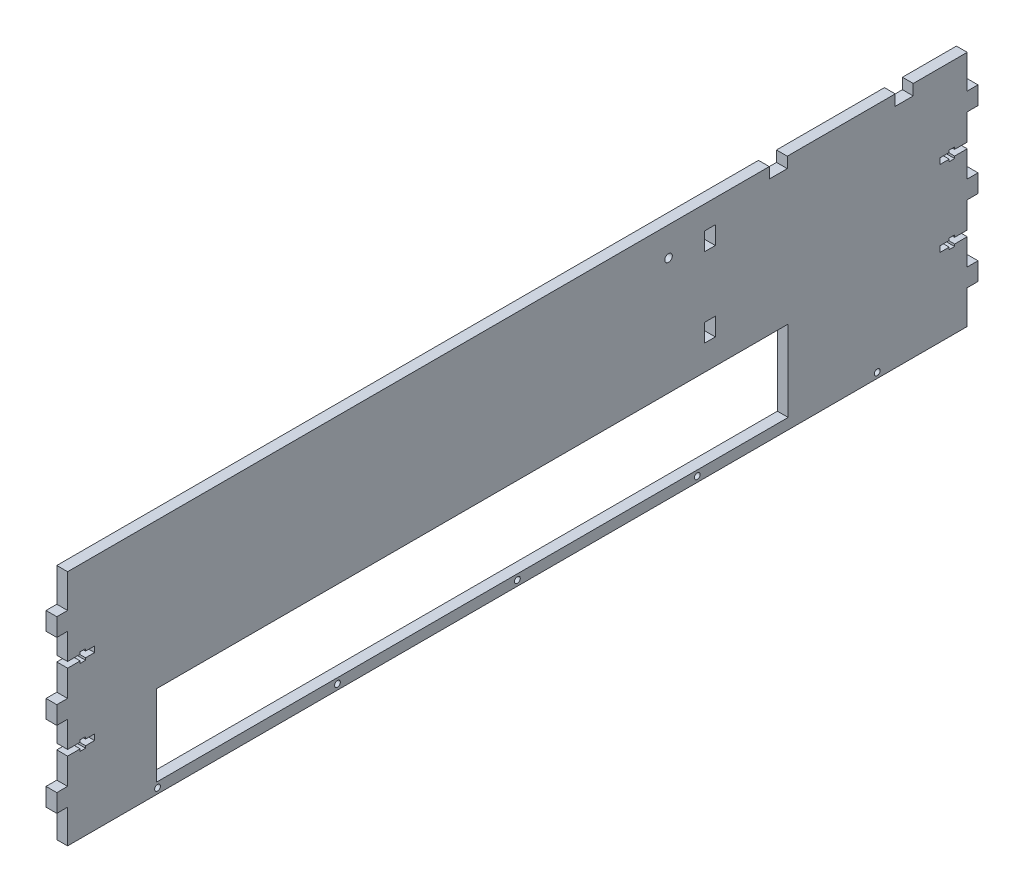
from build123d import *

# Parameters (mm, degrees)
SKETCH1_W           = 500
SKETCH1_H           = 132
BOSS_EXTRUDE1_DEPTH = 6
SKETCH4_W           = 6
SKETCH4_H           = 10
BOSS_EXTRUDE2_DEPTH = 6
CUT_EXTRUDE3_REACH  = 266.439
SKETCH6_W           = 6
SKETCH6_H           = 10
BOSS_EXTRUDE3_DEPTH = 6
CUT_EXTRUDE4_REACH  = 266.439
CUT_EXTRUDE5_REACH  = 266.439
SKETCH8_W           = 351
SKETCH8_H           = 44.95
CUT_EXTRUDE7_REACH  = 266.439
SKETCH10_R          = 1.6
CUT_EXTRUDE8_REACH  = 266.439
SKETCH11_W          = 6
SKETCH11_H          = 10
CUT_EXTRUDE9_REACH  = 266.439
SKETCH12_R          = 2.1
SKETCH13_W          = 6
SKETCH13_H          = 10
CUT_EXTRUDE10_DEPTH = 6


with BuildPart() as part:
    # Sketch1 → Boss-Extrude1 (new body)
    with BuildSketch(Plane(origin=(0, 0, 0), x_dir=(0, 0, -1), z_dir=(1, 0, 0))):
        Rectangle(SKETCH1_W, SKETCH1_H)
    extrude(amount=BOSS_EXTRUDE1_DEPTH)

    # Sketch4 → Boss-Extrude2 (add)
    with BuildSketch(Plane.XY.offset(250)):
        with Locations((3, 42.332128782)):
            Rectangle(SKETCH4_W, SKETCH4_H)
        with Locations((3, 0)):
            Rectangle(SKETCH4_W, SKETCH4_H)
        with Locations((3, -42.332128782)):
            Rectangle(SKETCH4_W, SKETCH4_H)
    extrude(amount=BOSS_EXTRUDE2_DEPTH)

    # Sketch5 → Cut-Extrude3 (cut, up to next)
    with BuildSketch(Plane.ZY, mode=Mode.PRIVATE) as cut_extrude3_sk1:
        Polygon((250, 19.566064391), (250, 22.766064391), (243, 22.766064391), (243, 23.966064391), (240, 23.966064391), (240, 22.766064391), (235, 22.766064391), (235, 19.566064391), (240, 19.566064391), (240, 18.366064391), (243, 18.366064391), (243, 19.566064391), align=None)
    cut_extrude3_tool1 = extrude(cut_extrude3_sk1.sketch, amount=-CUT_EXTRUDE3_REACH, mode=Mode.PRIVATE) & part.part
    # Sketch5 → Cut-Extrude3 (cut, up to next)
    with BuildSketch(Plane.ZY, mode=Mode.PRIVATE) as cut_extrude3_sk2:
        Polygon((243, -19.566064391), (243, -18.366064391), (240, -18.366064391), (240, -19.566064391), (235, -19.566064391), (235, -22.766064391), (240, -22.766064391), (240, -23.966064391), (243, -23.966064391), (243, -22.766064391), (250, -22.766064391), (250, -19.566064391), align=None)
    cut_extrude3_tool2 = extrude(cut_extrude3_sk2.sketch, amount=-CUT_EXTRUDE3_REACH, mode=Mode.PRIVATE) & part.part
    add(cut_extrude3_tool1.solids().sort_by_distance((0, 21.166064, 242.369565))[0], mode=Mode.SUBTRACT)
    add(cut_extrude3_tool2.solids().sort_by_distance((0, -21.166064, 242.369565))[0], mode=Mode.SUBTRACT)

    # Sketch6 → Boss-Extrude3 (add)
    with BuildSketch(Plane(origin=(0, 0, -250), x_dir=(-1, 0, 0), z_dir=(0, 0, -1))):
        with Locations((-3, 42.332128782)):
            Rectangle(SKETCH6_W, SKETCH6_H)
        with Locations((-3, 0)):
            Rectangle(SKETCH6_W, SKETCH6_H)
        with Locations((-3, -42.332128782)):
            Rectangle(SKETCH6_W, SKETCH6_H)
    extrude(amount=BOSS_EXTRUDE3_DEPTH)

    # Sketch7 → Cut-Extrude4 (cut, up to next)
    with BuildSketch(Plane.ZY, mode=Mode.PRIVATE) as cut_extrude4_sk1:
        Polygon((-250, -19.566064391), (-250, -22.766064391), (-243, -22.766064391), (-243, -23.966064391), (-240, -23.966064391), (-240, -22.766064391), (-235, -22.766064391), (-235, -19.566064391), (-240, -19.566064391), (-240, -18.366064391), (-243, -18.366064391), (-243, -19.566064391), align=None)
    cut_extrude4_tool1 = extrude(cut_extrude4_sk1.sketch, amount=-CUT_EXTRUDE4_REACH, mode=Mode.PRIVATE) & part.part
    # Sketch7 → Cut-Extrude4 (cut, up to next)
    with BuildSketch(Plane.ZY, mode=Mode.PRIVATE) as cut_extrude4_sk2:
        Polygon((-250, 22.766064391), (-250, 19.566064391), (-243, 19.566064391), (-243, 18.366064391), (-240, 18.366064391), (-240, 19.566064391), (-235, 19.566064391), (-235, 22.766064391), (-240, 22.766064391), (-240, 23.966064391), (-243, 23.966064391), (-243, 22.766064391), align=None)
    cut_extrude4_tool2 = extrude(cut_extrude4_sk2.sketch, amount=-CUT_EXTRUDE4_REACH, mode=Mode.PRIVATE) & part.part
    add(cut_extrude4_tool1.solids().sort_by_distance((0, -21.166064, -242.369565))[0], mode=Mode.SUBTRACT)
    add(cut_extrude4_tool2.solids().sort_by_distance((0, 21.166064, -242.369565))[0], mode=Mode.SUBTRACT)

    # Sketch8 → Cut-Extrude5 (cut, up to next)
    with BuildSketch(Plane.ZY, mode=Mode.PRIVATE) as cut_extrude5_sk1:
        with Locations((25, -37.525)):
            Rectangle(SKETCH8_W, SKETCH8_H)
    cut_extrude5_tool1 = extrude(cut_extrude5_sk1.sketch, amount=-CUT_EXTRUDE5_REACH, mode=Mode.PRIVATE) & part.part
    add(cut_extrude5_tool1.solids().sort_by_distance((0, -37.525, 25))[0], mode=Mode.SUBTRACT)

    # Sketch10 → Cut-Extrude7 (cut, up to next)
    with BuildSketch(Plane(origin=(6, 0, 0), x_dir=(0, 0, -1), z_dir=(1, 0, 0)), mode=Mode.PRIVATE) as cut_extrude7_sk1:
        with Locations((0, -63)):
            Circle(SKETCH10_R)
    cut_extrude7_tool1 = extrude(cut_extrude7_sk1.sketch, amount=-CUT_EXTRUDE7_REACH, mode=Mode.PRIVATE) & part.part
    # Sketch10 → Cut-Extrude7 (cut, up to next)
    with BuildSketch(Plane(origin=(6, 0, 0), x_dir=(0, 0, -1), z_dir=(1, 0, 0)), mode=Mode.PRIVATE) as cut_extrude7_sk2:
        with Locations((100, -63)):
            Circle(SKETCH10_R)
    cut_extrude7_tool2 = extrude(cut_extrude7_sk2.sketch, amount=-CUT_EXTRUDE7_REACH, mode=Mode.PRIVATE) & part.part
    # Sketch10 → Cut-Extrude7 (cut, up to next)
    with BuildSketch(Plane(origin=(6, 0, 0), x_dir=(0, 0, -1), z_dir=(1, 0, 0)), mode=Mode.PRIVATE) as cut_extrude7_sk3:
        with Locations((200, -63)):
            Circle(SKETCH10_R)
    cut_extrude7_tool3 = extrude(cut_extrude7_sk3.sketch, amount=-CUT_EXTRUDE7_REACH, mode=Mode.PRIVATE) & part.part
    # Sketch10 → Cut-Extrude7 (cut, up to next)
    with BuildSketch(Plane(origin=(6, 0, 0), x_dir=(0, 0, -1), z_dir=(1, 0, 0)), mode=Mode.PRIVATE) as cut_extrude7_sk4:
        with Locations((-100, -63)):
            Circle(SKETCH10_R)
    cut_extrude7_tool4 = extrude(cut_extrude7_sk4.sketch, amount=-CUT_EXTRUDE7_REACH, mode=Mode.PRIVATE) & part.part
    # Sketch10 → Cut-Extrude7 (cut, up to next)
    with BuildSketch(Plane(origin=(6, 0, 0), x_dir=(0, 0, -1), z_dir=(1, 0, 0)), mode=Mode.PRIVATE) as cut_extrude7_sk5:
        with Locations((-200, -63)):
            Circle(SKETCH10_R)
    cut_extrude7_tool5 = extrude(cut_extrude7_sk5.sketch, amount=-CUT_EXTRUDE7_REACH, mode=Mode.PRIVATE) & part.part
    add(cut_extrude7_tool1.solids().sort_by_distance((6, -63, 0))[0], mode=Mode.SUBTRACT)
    add(cut_extrude7_tool2.solids().sort_by_distance((6, -63, -100))[0], mode=Mode.SUBTRACT)
    add(cut_extrude7_tool3.solids().sort_by_distance((6, -63, -200))[0], mode=Mode.SUBTRACT)
    add(cut_extrude7_tool4.solids().sort_by_distance((6, -63, 100))[0], mode=Mode.SUBTRACT)
    add(cut_extrude7_tool5.solids().sort_by_distance((6, -63, 200))[0], mode=Mode.SUBTRACT)

    # Sketch11 → Cut-Extrude8 (cut, up to next)
    with BuildSketch(Plane(origin=(6, 0, 0), x_dir=(0, 0, -1), z_dir=(1, 0, 0)), mode=Mode.PRIVATE) as cut_extrude8_sk1:
        with Locations((107, 48)):
            Rectangle(SKETCH11_W, SKETCH11_H)
    cut_extrude8_tool1 = extrude(cut_extrude8_sk1.sketch, amount=-CUT_EXTRUDE8_REACH, mode=Mode.PRIVATE) & part.part
    # Sketch11 → Cut-Extrude8 (cut, up to next)
    with BuildSketch(Plane(origin=(6, 0, 0), x_dir=(0, 0, -1), z_dir=(1, 0, 0)), mode=Mode.PRIVATE) as cut_extrude8_sk2:
        with Locations((107, 4)):
            Rectangle(SKETCH11_W, SKETCH11_H)
    cut_extrude8_tool2 = extrude(cut_extrude8_sk2.sketch, amount=-CUT_EXTRUDE8_REACH, mode=Mode.PRIVATE) & part.part
    add(cut_extrude8_tool1.solids().sort_by_distance((6, 48, -107))[0], mode=Mode.SUBTRACT)
    add(cut_extrude8_tool2.solids().sort_by_distance((6, 4, -107))[0], mode=Mode.SUBTRACT)

    # Sketch12 → Cut-Extrude9 (cut, up to next)
    with BuildSketch(Plane.ZY, mode=Mode.PRIVATE) as cut_extrude9_sk1:
        with Locations((-84, 50)):
            Circle(SKETCH12_R)
    cut_extrude9_tool1 = extrude(cut_extrude9_sk1.sketch, amount=-CUT_EXTRUDE9_REACH, mode=Mode.PRIVATE) & part.part
    add(cut_extrude9_tool1.solids().sort_by_distance((0, 50, -84))[0], mode=Mode.SUBTRACT)

    # Sketch13 → Cut-Extrude10 (cut)
    with BuildSketch(Plane(origin=(0, 66, 0), x_dir=(1, 0, 0), z_dir=(0, 1, 0))):
        with Locations((3, 215)):
            Rectangle(SKETCH13_W, SKETCH13_H)
        with Locations((3, 145)):
            Rectangle(SKETCH13_W, SKETCH13_H)
    extrude(amount=-CUT_EXTRUDE10_DEPTH, mode=Mode.SUBTRACT)


solid = part.part
